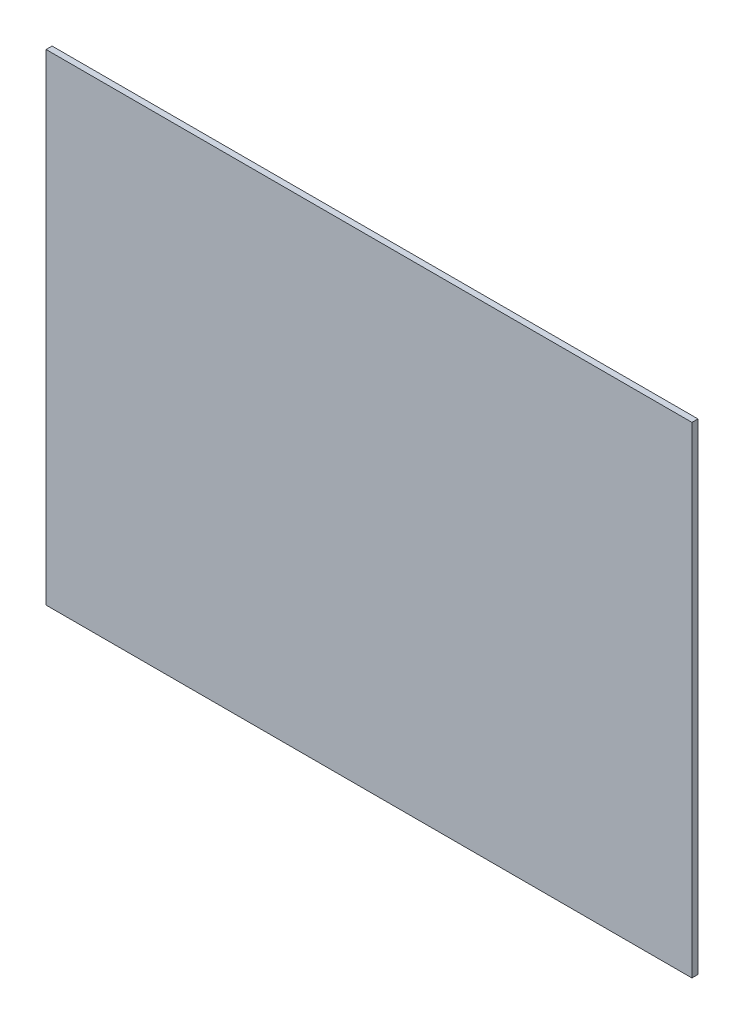
from build123d import *

# Parameters (mm, degrees)
SKETCH2_W           = 254
SKETCH2_H           = 189.23
BOSS_EXTRUDE1_DEPTH = 2.3622


with BuildPart() as part:
    # Sketch2 → Boss-Extrude1 (new body)
    with BuildSketch(Plane.XY):
        with Locations((127, 94.615)):
            Rectangle(SKETCH2_W, SKETCH2_H)
    extrude(amount=BOSS_EXTRUDE1_DEPTH)


solid = part.part
